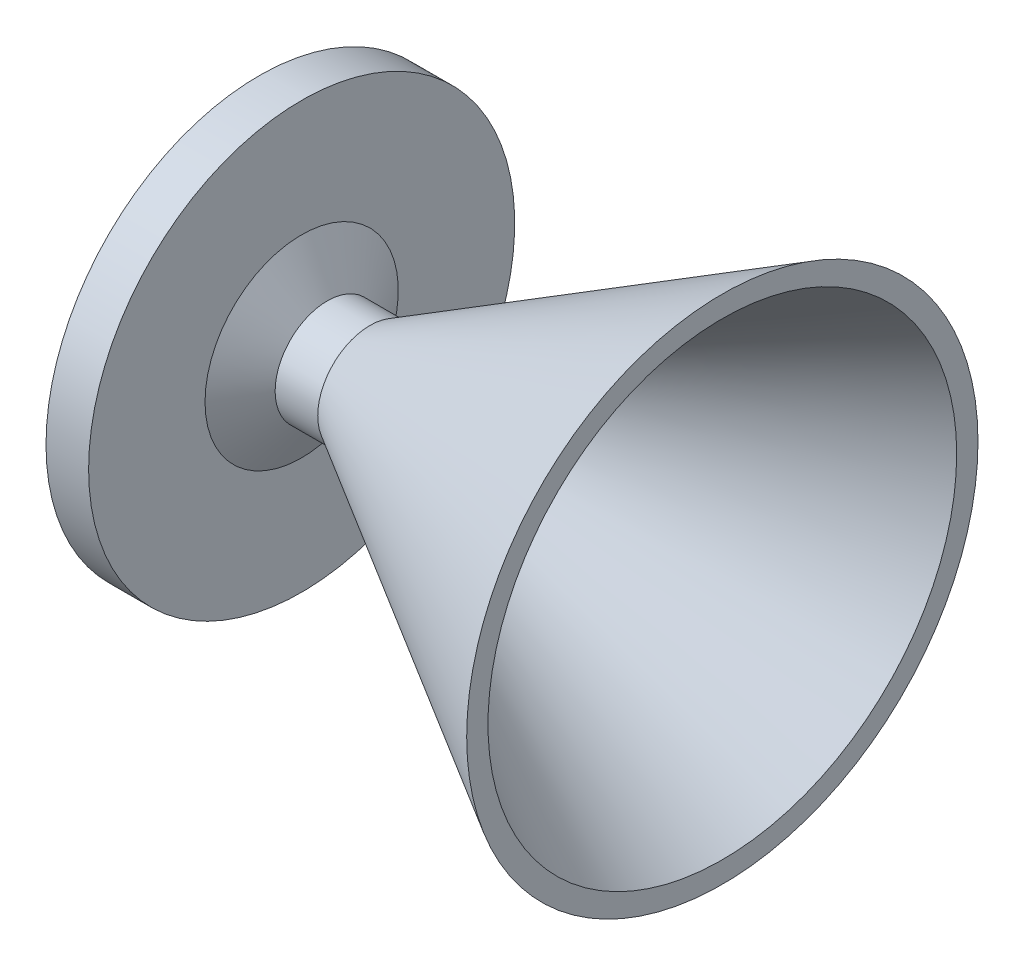
from build123d import *


with BuildPart() as part:
    # Sketch1 → Revolve1 (revolve)
    with BuildSketch(Plane.XY):
        Polygon((0, 15.5575), (105.035891098, 76.2), (105.035891098, 69.85), (0, 7.9375), (-12.7, 7.9375), (-33.047266862, 44.45), (-33.047266862, 50.8), (-33.047266862, 63.5), (-20.347266862, 63.5), (-20.347266862, 28.802954744), (-12.7, 15.5575), align=None)
    revolve(axis=Axis((0, 0, 0), (1, 0, 0)))


solid = part.part
